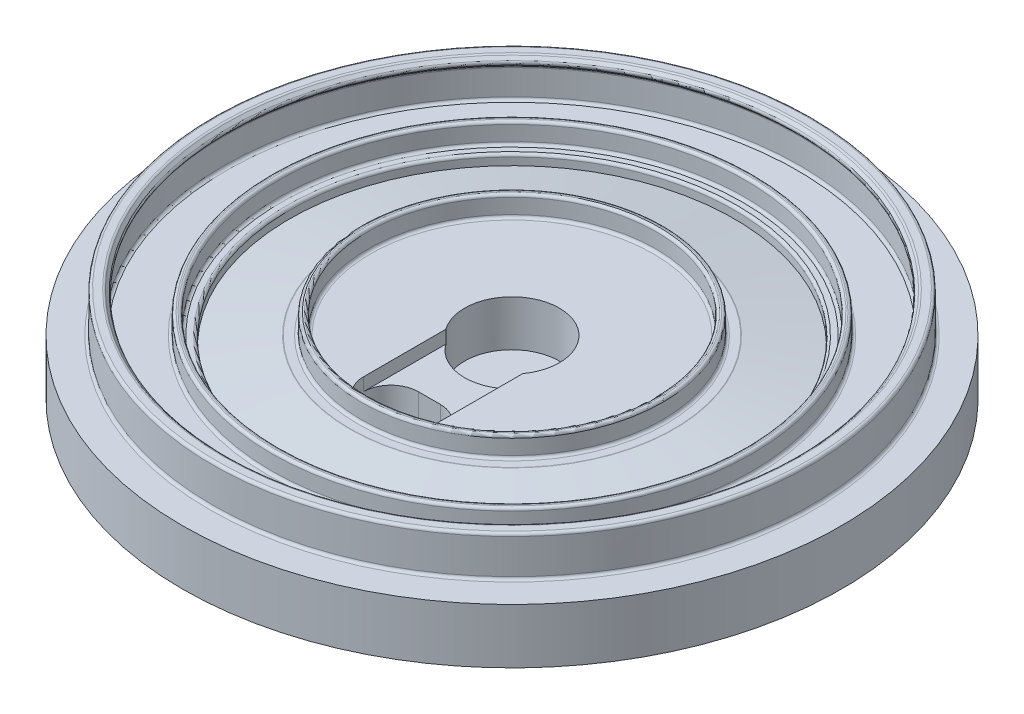
from build123d import *

# Parameters (mm, degrees)
SKETCH1_R           = 60
BOSS_EXTRUDE1_DEPTH = 10
SKETCH3_R           = 43.75
SKETCH3_R_2         = 42.5
SKETCH3_R_3         = 27.5
SKETCH3_R_4         = 26.25
BOSS_EXTRUDE2_DEPTH = 3.723
FILLET1_R           = 0.5
FILLET2_R           = 0.5
SKETCH6_R           = 8.625
CUT_EXTRUDE1_DEPTH  = 8.354
SKETCH9_W           = 14
SKETCH9_H           = 15
CUT_EXTRUDE2_DEPTH  = 2.354
CUT_EXTRUDE3_DEPTH  = 10


with BuildPart() as part:
    # Sketch1 → Boss-Extrude1 (new body)
    with BuildSketch(Plane(origin=(0, 0, 0), x_dir=(1, 0, 0), z_dir=(0, 1, 0))):
        Circle(SKETCH1_R)
    extrude(amount=BOSS_EXTRUDE1_DEPTH)

    # Sketch2 → Cut-Revolve1 (revolve, cut)
    with BuildSketch(Plane.XY):
        Polygon((-29.5, 10), (-40.5, 8.127), (-40.5, 10), align=None)
    revolve(axis=Axis((0, 10, 0), (0, -1, 0)), mode=Mode.SUBTRACT)

    # Sketch3 → Boss-Extrude2 (add)
    # profile 1 of 2: a face of its own
    with BuildSketch(Plane(origin=(0, 10, 0), x_dir=(1, 0, 0), z_dir=(0, 1, 0))):
        Circle(SKETCH3_R)
        Circle(SKETCH3_R_2, mode=Mode.SUBTRACT)
    # profile 2 of 2: a face of its own
    with BuildSketch(Plane(origin=(0, 10, 0), x_dir=(1, 0, 0), z_dir=(0, 1, 0))):
        Circle(SKETCH3_R_3)
        Circle(SKETCH3_R_4, mode=Mode.SUBTRACT)
    extrude(amount=BOSS_EXTRUDE2_DEPTH)

    # Fillet1
    fillet1_edges = [part.edges().sort_by_distance(p)[0] for p in [
        (-26.25, 10, 0),
        (-27.5, 10, 0),
        (-43.75, 10, 0),
        (-42.5, 10, 0),
        (40.5, 10, 0),
        (-27.5, 13.723, 0),
        (-26.25, 13.723, 0),
        (-43.75, 13.723, 0),
        (-42.5, 13.723, 0),
        (29.5, 10, 0),
    ]]
    fillet(fillet1_edges, radius=FILLET1_R)

    # Sketch5 → Revolve1 (revolve)
    with BuildSketch(Plane.XY):
        Polygon((-52.5, 10), (-54.5, 10), (-54.5, 17.323), (-52.5, 17.323), (-51.5, 16.323), (-52.5, 15.323), align=None)
    revolve(axis=Axis((0, 10, 0), (0, 1, 0)))

    # Fillet2
    fillet2_edges = [part.edges().sort_by_distance(p)[0] for p in [
        (52.5, 10, 0),
        (52.5, 15.323, 0),
        (52.5, 17.323, 0),
        (51.5, 16.323, 0),
        (54.5, 10, 0),
        (54.5, 17.323, 0),
    ]]
    fillet(fillet2_edges, radius=FILLET2_R)

    # Sketch6 → Cut-Extrude1 (cut)
    with BuildSketch(Plane(origin=(0, 10, 0), x_dir=(1, 0, 0), z_dir=(0, 1, 0))):
        Circle(SKETCH6_R)
    extrude(amount=-CUT_EXTRUDE1_DEPTH, mode=Mode.SUBTRACT)

    # Sketch9 → Cut-Extrude2 (cut)
    with BuildSketch(Plane(origin=(0, 10, 0), x_dir=(1, 0, 0), z_dir=(0, 1, 0))):
        with Locations((0, -12.538911093)):
            Rectangle(SKETCH9_W, SKETCH9_H)
    extrude(amount=-CUT_EXTRUDE2_DEPTH, mode=Mode.SUBTRACT)

    # Sketch10 → Cut-Extrude3 (cut)
    with BuildSketch(Plane(origin=(0, 10, 0), x_dir=(1, 0, 0), z_dir=(0, 1, 0))):
        with BuildLine():
            Line((2, -25.038911093), (-2, -25.038911093))
            ThreePointArc((-2, -25.038911093), (-7, -20.038911093), (-2, -15.038911093))
            Line((-2, -15.038911093), (2, -15.038911093))
            ThreePointArc((2, -15.038911093), (7, -20.038911093), (2, -25.038911093))
        make_face()
    extrude(amount=-CUT_EXTRUDE3_DEPTH, mode=Mode.SUBTRACT)


solid = part.part
